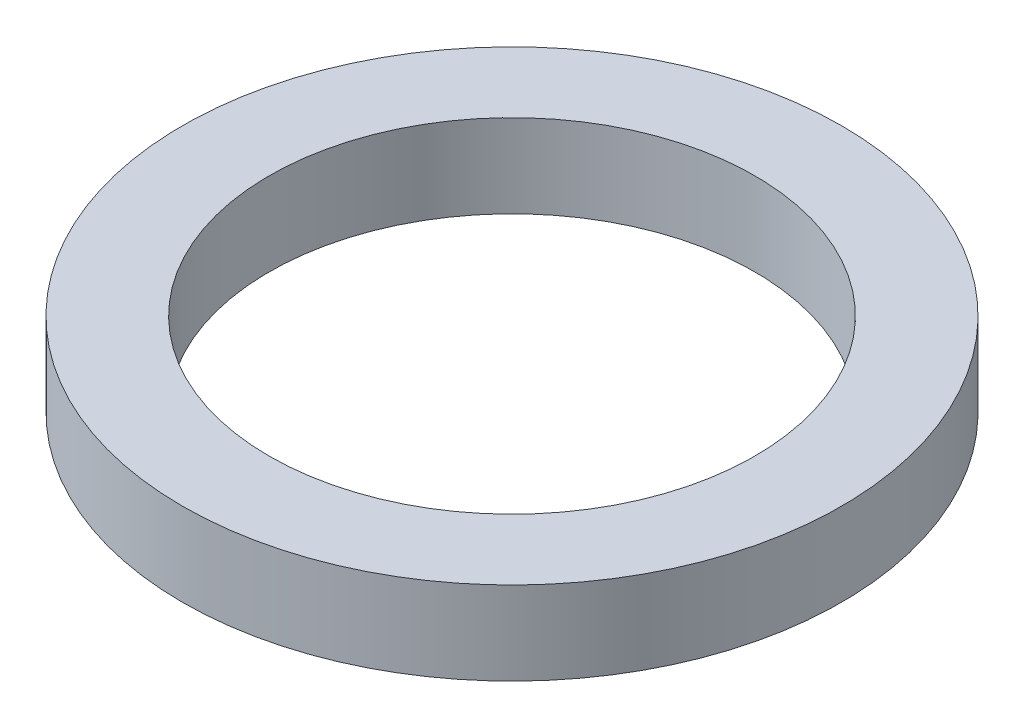
from build123d import *

# Parameters (mm, degrees)
SKETCH1_R           = 47.5
BOSS_EXTRUDE1_DEPTH = 12
SKETCH2_R           = 35
CUT_EXTRUDE1_DEPTH  = 69.238552153


with BuildPart() as part:
    # Sketch1 → Boss-Extrude1 (new body)
    with BuildSketch(Plane(origin=(0, 0, 0), x_dir=(1, 0, 0), z_dir=(0, 1, 0))):
        Circle(SKETCH1_R)
    extrude(amount=BOSS_EXTRUDE1_DEPTH)

    # Sketch2 → Cut-Extrude1 (cut, through all)
    with BuildSketch(Plane(origin=(0, 0, 0), x_dir=(1, 0, 0), z_dir=(0, 1, 0))):
        Circle(SKETCH2_R)
    extrude(amount=CUT_EXTRUDE1_DEPTH, mode=Mode.SUBTRACT)


solid = part.part
